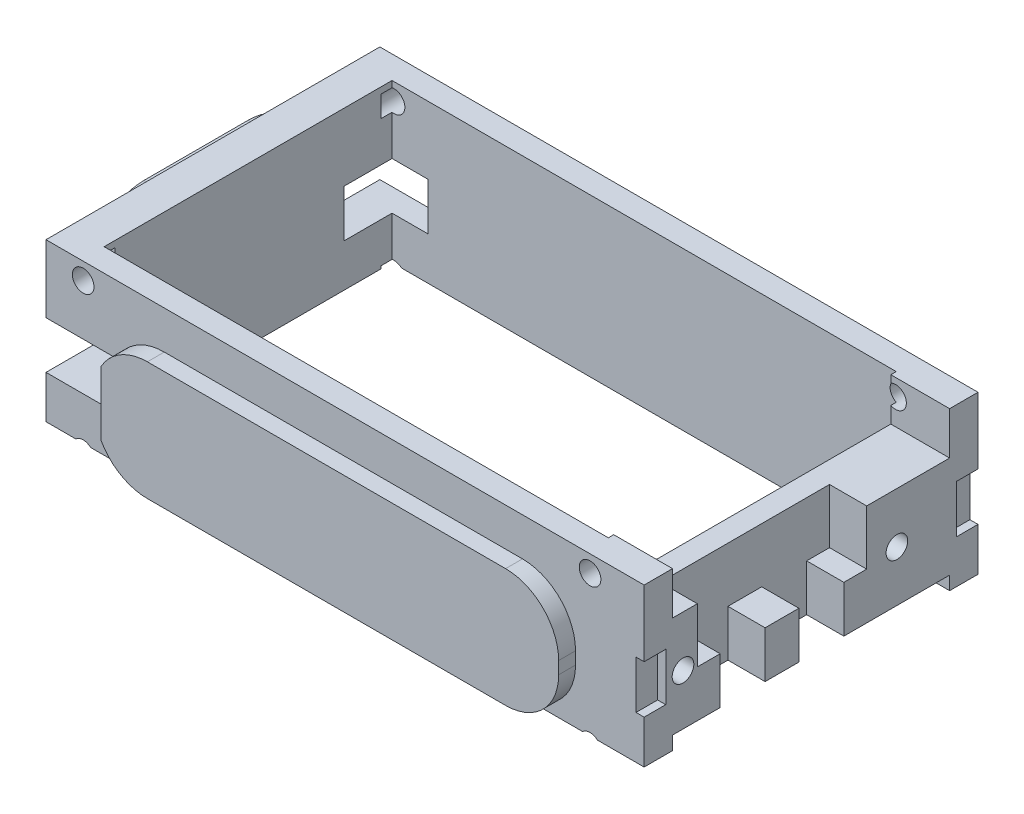
from build123d import *

# Parameters (mm, degrees)
SKETCH_2_W               = 69
SKETCH_2_H               = 17.83
EXTRUDE_1_DEPTH          = 2.5
FILLET_1_R               = 8
SKETCH_3_W               = 88.5
SKETCH_3_H               = 23.33
EXTRUDE_2_DEPTH          = 4.2
SKETCH_4_W               = 41
SKETCH_4_H               = 23.33
EXTRUDE_3_DEPTH          = 6
SKETCH_5_W               = 88.5
SKETCH_5_H               = 23.33
EXTRUDE_4_DEPTH          = 4.2
EXTRUDE_5_DEPTH          = 2.5
SKETCH_7_W               = 10.5
SKETCH_7_H               = 7
CUT_EXTRUDE_1_DEPTH      = 10.5
SKETCH_9_W               = 31.4
SKETCH_9_H               = 23
EXTRUDE_6_DEPTH          = 2.5
FILLET_3_R               = 8
SKETCH_11_W              = 5
SKETCH_11_H              = 6.9
EXTRUDE_7_DEPTH          = 8.5
SKETCH_13_W              = 41
SKETCH_13_H              = 15
EXTRUDE_8_DEPTH          = 3
SKETCH_12_W              = 3.2
SKETCH_12_H              = 7.1
CUT_EXTRUDE_3_DEPTH      = 1.2
SKETCH_10_W              = 1.5
SKETCH_10_H              = 7
CUT_EXTRUDE_4_DEPTH      = 5
CUT_EXTRUDE_5_DEPTH      = 97.190014555
CUT_EXTRUDE_5_DEPTH_BACK = 97.190014555
CUT_EXTRUDE_6_DEPTH      = 97.039627238
CUT_EXTRUDE_6_DEPTH_BACK = 97.039627238
SKETCH_15_W              = 0.823752297
SKETCH_15_H              = 2.5
SKETCH_18_W              = 41
SKETCH_18_H              = 15
EXTRUDE_10_DEPTH         = 1
CUT_EXTRUDE_7_DEPTH      = 107.266264167
CUT_EXTRUDE_7_DEPTH_BACK = 9.5
SKETCH_16_R              = 1.6
CUT_EXTRUDE_8_DEPTH      = 3
CUT_EXTRUDE_8_DEPTH_BACK = 3.6
CUT_EXTRUDE_9_DEPTH      = 2.5
CUT_EXTRUDE_10_DEPTH     = 2.5
SKETCH_22_W              = 0.12
SKETCH_22_H              = 8.1
EXTRUDE_11_DEPTH         = 5.5
CUT_EXTRUDE_14_DEPTH     = 2.5
SKETCH_24_W              = 74.6
SKETCH_24_H              = 42.6
SKETCH_24_W_2            = 73
SKETCH_24_H_2            = 41
CUT_EXTRUDE_15_DEPTH     = 98.359636914
SKETCH_25_R              = 1.6
CUT_EXTRUDE_17_DEPTH     = 5
SKETCH_26_R              = 1.6
CUT_EXTRUDE_18_DEPTH     = 4


with BuildPart() as part:
    # 草图2 → 凸台-拉伸1 (new body)
    with BuildSketch(Plane.XY):
        with Locations((34.5, -8.915)):
            Rectangle(SKETCH_2_W, SKETCH_2_H)
    extrude(amount=EXTRUDE_1_DEPTH)

    # 圆角1
    fillet_1_edges = [part.edges().sort_by_distance(p)[0] for p in [
        (0, 0, 1.25),
        (69, 0, 1.25),
        (69, -17.83, 1.25),
        (0, -17.83, 1.25),
    ]]
    fillet(fillet_1_edges, radius=FILLET_1_R)

    # 草图3 → 凸台-拉伸2 (add)
    with BuildSketch(Plane(origin=(0, 0, 0), x_dir=(-1, 0, 0), z_dir=(0, 0, -1))):
        with Locations((-34.75, -6.165)):
            Rectangle(SKETCH_3_W, SKETCH_3_H)
    extrude(amount=EXTRUDE_2_DEPTH)

    # 草图4 → 凸台-拉伸3 (add)
    with BuildSketch(Plane.ZY.offset(9.5)):
        with Locations((-24.7, -6.165)):
            Rectangle(SKETCH_4_W, SKETCH_4_H)
    extrude(amount=-EXTRUDE_3_DEPTH)

    # 草图5 → 凸台-拉伸4 (add)
    with BuildSketch(Plane(origin=(0, 0, -45.2), x_dir=(-1, 0, 0), z_dir=(0, 0, -1))):
        with Locations((-34.75, -6.165)):
            Rectangle(SKETCH_5_W, SKETCH_5_H)
    extrude(amount=EXTRUDE_4_DEPTH)

    # 草图6 → 凸台-拉伸5 (add)
    with BuildSketch(Plane(origin=(0, 0, -49.4), x_dir=(-1, 0, 0), z_dir=(0, 0, -1))):
        with BuildLine():
            Line((-69, -8), (-69, -9.83))
            ThreePointArc((-69, -9.83), (-66.656854249, -15.486854249), (-61, -17.83))
            Line((-61, -17.83), (-8, -17.83))
            ThreePointArc((-8, -17.83), (-2.343145751, -15.486854249), (0, -9.83))
            Line((0, -9.83), (0, -8))
            ThreePointArc((0, -8), (-2.343145751, -2.343145751), (-8, 0))
            Line((-8, 0), (-61, 0))
            ThreePointArc((-61, 0), (-66.656854249, -2.343145751), (-69, -8))
        make_face()
    extrude(amount=EXTRUDE_5_DEPTH)

    # 草图7 → 切除-拉伸1 (cut)
    with BuildSketch(Plane.ZY.offset(9.5)):
        with Locations((-44.15, -8)):
            Rectangle(SKETCH_7_W, SKETCH_7_H)
        with Locations((-5.25, -8)):
            Rectangle(SKETCH_7_W, SKETCH_7_H)
    extrude(amount=-CUT_EXTRUDE_1_DEPTH, mode=Mode.SUBTRACT)

    # 草图9 → 凸台-拉伸6 (add)
    with BuildSketch(Plane.ZY.offset(9.5)):
        with Locations((-24.7, -8)):
            Rectangle(SKETCH_9_W, SKETCH_9_H)
    extrude(amount=EXTRUDE_6_DEPTH)

    # 圆角3
    # the kernel refuses this fillet: 8 mm, written as the material it takes off along each edge
    with BuildSketch(Plane(origin=(-9.5, -19.5, -9), x_dir=(0, 1, 0), z_dir=(-1, 0, 0))) as fillet_3_piece_1:
        with BuildLine():
            CenterArc((FILLET_3_R, FILLET_3_R), FILLET_3_R, 180, 90)
            Line((0, FILLET_3_R), (0, 0))
            Line((0, 0), (FILLET_3_R, 0))
        make_face()
    extrude(amount=22.5, mode=Mode.SUBTRACT)
    with BuildSketch(Plane(origin=(-9.5, 3.5, -9), x_dir=(0, -1, 0), z_dir=(-1, 0, 0)), Plane(origin=(-9.5, 3.5, -40.4), x_dir=(0, 0, 1), z_dir=(-1, 0, 0)), Plane(origin=(-9.5, -19.5, -40.4), x_dir=(0, 1, 0), z_dir=(-1, 0, 0))) as fillet_3_piece_2:
        with BuildLine():
            CenterArc((FILLET_3_R, -FILLET_3_R), FILLET_3_R, 90, 90)
            Line((0, -FILLET_3_R), (0, 0))
            Line((0, 0), (FILLET_3_R, 0))
        make_face()
    extrude(amount=22.5, mode=Mode.SUBTRACT)

    # 草图11 → 凸台-拉伸7 (add)
    with BuildSketch(Plane(origin=(79, 0, 0), x_dir=(0, 0, -1), z_dir=(1, 0, 0))):
        Polygon((49.3, -0.83), (33.05, -0.83), (33.05, -8.93), (29.55, -8.93), (29.55, -15.83), (49.3, -15.83), align=None)
        Polygon((0, -15.83), (11.25, -15.83), (11.25, -8.93), (7.75, -8.93), (7.75, -0.83), (0, -0.83), align=None)
        with Locations((20.4, -12.38)):
            Rectangle(SKETCH_11_W, SKETCH_11_H)
    extrude(amount=-EXTRUDE_7_DEPTH)


with BuildPart() as extrude_7_piece_1:
    # of the separate pieces the step leaves, piece 1, a body of its own (extrude_7_pieces)
    add(part.part.solids().sort_by_distance((79, 5.5, 0))[0])



with BuildPart() as extrude_7_piece_2:
    # of the separate pieces the step leaves, piece 2, a body of its own (extrude_7_pieces)
    add(part.part.solids().sort_by_distance((79, -15.83, -17.9))[0])


with BuildPart() as extrude_7_piece_1_1:
    add(extrude_7_piece_1.part)

    add(extrude_7_piece_2.part)  # 凸台-拉伸8 merges 凸台-拉伸7 piece 2
    # 草图13 → 凸台-拉伸8 (add)
    with BuildSketch(Plane.ZY.offset(-70.5)):
        with Locations((-24.7, -8.33)):
            Rectangle(SKETCH_13_W, SKETCH_13_H)
    extrude(amount=-EXTRUDE_8_DEPTH)

    # 草图12 → 切除-拉伸3 (cut)
    with BuildSketch(Plane(origin=(79, 0, 0), x_dir=(0, 0, -1), z_dir=(1, 0, 0))):
        with Locations((1.6, -7.88)):
            Rectangle(SKETCH_12_W, SKETCH_12_H)
        with Locations((47.8, -7.88)):
            Rectangle(SKETCH_12_W, SKETCH_12_H)
    extrude(amount=-CUT_EXTRUDE_3_DEPTH, mode=Mode.SUBTRACT)

    # 草图10 → 切除-拉伸4 (cut)
    with BuildSketch(Plane(origin=(-9.5, 0, 0), x_dir=(0, 0, -1), z_dir=(1, 0, 0))):
        with BuildLine():
            Line((37.291942355, -17.83), (12.108057645, -17.83))
            ThreePointArc((12.108057645, -17.83), (14.415430403, -19.070997292), (17, -19.5))
            Line((17, -19.5), (32.4, -19.5))
            ThreePointArc((32.4, -19.5), (34.984569597, -19.070997292), (37.291942355, -17.83))
        make_face()
        with Locations((39.65, -8)):
            Rectangle(SKETCH_10_W, SKETCH_10_H)
        with Locations((9.75, -8)):
            Rectangle(SKETCH_10_W, SKETCH_10_H)
    extrude(amount=-CUT_EXTRUDE_4_DEPTH, mode=Mode.SUBTRACT)

    # 草图14 → 切除-拉伸5 (cut, two sides: drawn at the far end of the back side and taken through both)
    with BuildSketch(Plane.XY.offset(-49.4).offset(-CUT_EXTRUDE_5_DEPTH_BACK)):
        with BuildLine():
            Line((0.176247703, -11.5), (1, -11.5))
            Line((1, -11.5), (1, -4.5))
            Line((1, -4.5), (0.806252715, -4.5))
            ThreePointArc((0.806252715, -4.5), (0.204168477, -6.204168477), (0, -8))
            Line((0, -8), (0, -9.83))
            ThreePointArc((0, -9.83), (0.04418394, -10.669637311), (0.176247703, -11.5))
        make_face()
    extrude(amount=CUT_EXTRUDE_5_DEPTH + CUT_EXTRUDE_5_DEPTH_BACK, mode=Mode.SUBTRACT)

    # 草图15 → 切除-拉伸6 (cut, two sides: drawn at the far end of the back side and taken through both)
    with BuildSketch(Plane(origin=(0, -11.5, 0), x_dir=(1, 0, 0), z_dir=(0, 1, 0)).offset(-CUT_EXTRUDE_6_DEPTH_BACK)):
        with Locations((0.588123852, 50.65)):
            Rectangle(SKETCH_15_W, SKETCH_15_H)
        with Locations((0.588123852, -1.25)):
            Rectangle(SKETCH_15_W, SKETCH_15_H)
    extrude(amount=CUT_EXTRUDE_6_DEPTH + CUT_EXTRUDE_6_DEPTH_BACK, mode=Mode.SUBTRACT)

    # 草图18 → 凸台-拉伸10 (add)
    with BuildSketch(Plane.ZY.offset(-70.5)):
        with Locations((-24.7, -8.33)):
            Rectangle(SKETCH_18_W, SKETCH_18_H)
    extrude(amount=EXTRUDE_10_DEPTH)

    # 草图16 → 切除-拉伸7 (cut, two sides: drawn at the far end of the back side and taken through both)
    with BuildSketch(Plane(origin=(79, 0, 0), x_dir=(0, 0, -1), z_dir=(1, 0, 0)).offset(-CUT_EXTRUDE_7_DEPTH_BACK)):
        with Locations(Location((37.4, -8.33, 0), (0, 0, 180))):
            Circle(SKETCH_16_R)
        with Locations(Location((5.75, -8.33, 0), (0, 0, 165.638488437))):
            Circle(SKETCH_16_R)
    extrude(amount=CUT_EXTRUDE_7_DEPTH + CUT_EXTRUDE_7_DEPTH_BACK, mode=Mode.SUBTRACT)

    # 草图19 → 切除-拉伸8 (cut, two sides: drawn at the far end of the back side and taken through both)
    with BuildSketch(Plane.ZY.offset(-69.5).offset(-CUT_EXTRUDE_8_DEPTH_BACK)):
        Polygon((-37.4, -5.212308546), (-40.1, -6.771154273), (-40.1, -9.888845727), (-37.4, -11.447691454), (-34.7, -9.888845727), (-34.7, -6.771154273), align=None)
        Polygon((-5.75, -5.212308546), (-8.45, -6.771154273), (-8.45, -9.888845727), (-5.75, -11.447691454), (-3.05, -9.888845727), (-3.05, -6.771154273), align=None)
    extrude(amount=CUT_EXTRUDE_8_DEPTH + CUT_EXTRUDE_8_DEPTH_BACK, mode=Mode.SUBTRACT)

    # 草图20 → 切除-拉伸9 (cut)
    with BuildSketch(Plane.XY.offset(2.5)):
        with BuildLine():
            Line((1, -4.127016654), (1, -13.702983346))
            ThreePointArc((1, -13.702983346), (3.936987987, -16.721439137), (8, -17.83))
            Line((8, -17.83), (61, -17.83))
            ThreePointArc((61, -17.83), (66.656854249, -15.486854249), (69, -9.83))
            Line((69, -9.83), (69, -8))
            ThreePointArc((69, -8), (66.656854249, -2.343145751), (61, 0))
            Line((61, 0), (8, 0))
            ThreePointArc((8, 0), (3.936987987, -1.108560863), (1, -4.127016654))
        make_face()
        with BuildLine():
            Line((1.15, -4.165942097), (1.15, -13.664057903))
            ThreePointArc((1.15, -13.664057903), (4.029789334, -16.601995811), (8, -17.68))
            Line((8, -17.68), (61, -17.68))
            ThreePointArc((61, -17.68), (66.550788232, -15.380788232), (68.85, -9.83))
            Line((68.85, -9.83), (68.85, -8))
            ThreePointArc((68.85, -8), (66.550788232, -2.449211768), (61, -0.15))
            Line((61, -0.15), (8, -0.15))
            ThreePointArc((8, -0.15), (4.029789334, -1.228004189), (1.15, -4.165942097))
        make_face(mode=Mode.SUBTRACT)
    extrude(amount=-CUT_EXTRUDE_9_DEPTH, mode=Mode.SUBTRACT)

    # 草图21 → 切除-拉伸10 (cut)
    with BuildSketch(Plane(origin=(0, 0, -51.9), x_dir=(-1, 0, 0), z_dir=(0, 0, -1))):
        with BuildLine():
            Line((-1, -13.702983346), (-1, -4.127016654))
            ThreePointArc((-1, -4.127016654), (-3.936987987, -1.108560863), (-8, 0))
            Line((-8, 0), (-61, 0))
            ThreePointArc((-61, 0), (-66.656854249, -2.343145751), (-69, -8))
            Line((-69, -8), (-69, -9.83))
            ThreePointArc((-69, -9.83), (-66.656854249, -15.486854249), (-61, -17.83))
            Line((-61, -17.83), (-8, -17.83))
            ThreePointArc((-8, -17.83), (-3.936987987, -16.721439137), (-1, -13.702983346))
        make_face()
        with BuildLine():
            Line((-1.15, -13.664057903), (-1.15, -4.165942097))
            ThreePointArc((-1.15, -4.165942097), (-4.029789334, -1.228004189), (-8, -0.15))
            Line((-8, -0.15), (-61, -0.15))
            ThreePointArc((-61, -0.15), (-66.550788232, -2.449211768), (-68.85, -8))
            Line((-68.85, -8), (-68.85, -9.83))
            ThreePointArc((-68.85, -9.83), (-66.550788232, -15.380788232), (-61, -17.68))
            Line((-61, -17.68), (-8, -17.68))
            ThreePointArc((-8, -17.68), (-4.029789334, -16.601995811), (-1.15, -13.664057903))
        make_face(mode=Mode.SUBTRACT)
    extrude(amount=-CUT_EXTRUDE_10_DEPTH, mode=Mode.SUBTRACT)

    # 草图22 → 凸台-拉伸11 (add)
    with BuildSketch(Plane(origin=(73.5, 0, 0), x_dir=(0, 0, -1), z_dir=(1, 0, 0))):
        with Locations((7.81, -4.88)):
            Rectangle(SKETCH_22_W, SKETCH_22_H)
        with Locations((32.99, -4.88)):
            Rectangle(SKETCH_22_W, SKETCH_22_H)
    extrude(amount=EXTRUDE_11_DEPTH)

    # 草图23 → 切除-拉伸14 (cut)
    with BuildSketch(Plane.ZY.offset(12)):
        with BuildLine():
            Line((-37.291942355, -17.83), (-12.108057645, -17.83))
            ThreePointArc((-12.108057645, -17.83), (-9.818929786, -15.025936837), (-9, -11.5))
            Line((-9, -11.5), (-10.5, -11.5))
            Line((-10.5, -11.5), (-10.5, -4.5))
            Line((-10.5, -4.5), (-9, -4.5))
            ThreePointArc((-9, -4.5), (-11.343145751, 1.156854249), (-17, 3.5))
            Line((-17, 3.5), (-32.4, 3.5))
            ThreePointArc((-32.4, 3.5), (-38.056854249, 1.156854249), (-40.4, -4.5))
            Line((-40.4, -4.5), (-38.9, -4.5))
            Line((-38.9, -4.5), (-38.9, -11.5))
            Line((-38.9, -11.5), (-40.4, -11.5))
            ThreePointArc((-40.4, -11.5), (-39.581070214, -15.025936837), (-37.291942355, -17.83))
        make_face()
        with BuildLine():
            Line((-37.240464854, -17.68), (-12.159535146, -17.68))
            ThreePointArc((-12.159535146, -17.68), (-9.975535198, -15.004196663), (-9.151433252, -11.65))
            Line((-9.151433252, -11.65), (-10.65, -11.65))
            Line((-10.65, -11.65), (-10.65, -4.35))
            Line((-10.65, -4.35), (-9.151433252, -4.35))
            ThreePointArc((-9.151433252, -4.35), (-11.502500568, 1.10357029), (-17, 3.35))
            Line((-17, 3.35), (-32.4, 3.35))
            ThreePointArc((-32.4, 3.35), (-37.897499432, 1.10357029), (-40.248566748, -4.35))
            Line((-40.248566748, -4.35), (-38.75, -4.35))
            Line((-38.75, -4.35), (-38.75, -11.65))
            Line((-38.75, -11.65), (-40.248566748, -11.65))
            ThreePointArc((-40.248566748, -11.65), (-39.424464802, -15.004196663), (-37.240464854, -17.68))
        make_face(mode=Mode.SUBTRACT)
    extrude(amount=-CUT_EXTRUDE_14_DEPTH, mode=Mode.SUBTRACT)

    # 草图24 → 切除-拉伸15 (cut, through all)
    with BuildSketch(Plane(origin=(0, 5.5, 0), x_dir=(1, 0, 0), z_dir=(0, 1, 0))):
        with Locations((33, 24.7)):
            Rectangle(SKETCH_24_W, SKETCH_24_H)
        with Locations((33, 24.7)):
            Rectangle(SKETCH_24_W_2, SKETCH_24_H_2, mode=Mode.SUBTRACT)
    extrude(amount=-CUT_EXTRUDE_15_DEPTH, mode=Mode.SUBTRACT)

    # 草图25 → 切除-拉伸17 (cut)
    with BuildSketch(Plane(origin=(0, 0, -49.4), x_dir=(-1, 0, 0), z_dir=(0, 0, -1))):
        with Locations((4, 3)):
            Circle(SKETCH_25_R)
        with Locations((4, -19)):
            Circle(SKETCH_25_R)
        with Locations((-71, 3)):
            Circle(SKETCH_25_R)
        with Locations((-71, -19)):
            Circle(SKETCH_25_R)
    cut_extrude_17 = extrude(amount=-CUT_EXTRUDE_17_DEPTH, mode=Mode.SUBTRACT)

    # 镜向1: 切除-拉伸17 across plane
    add(cut_extrude_17.mirror(Plane.XY.offset(-24.7)), mode=Mode.SUBTRACT)

    # 草图26 → 切除-拉伸18 (cut)
    with BuildSketch(Plane.ZY.offset(9.5)):
        with Locations((-47.2, -0.5)):
            Circle(SKETCH_26_R)
        with Locations((-2.2, -0.5)):
            Circle(SKETCH_26_R)
        with Locations((-2.2, -19)):
            Circle(SKETCH_26_R)
        with Locations((-47.2, -19)):
            Circle(SKETCH_26_R)
    extrude(amount=-CUT_EXTRUDE_18_DEPTH, mode=Mode.SUBTRACT)


solid = extrude_7_piece_1_1.part
